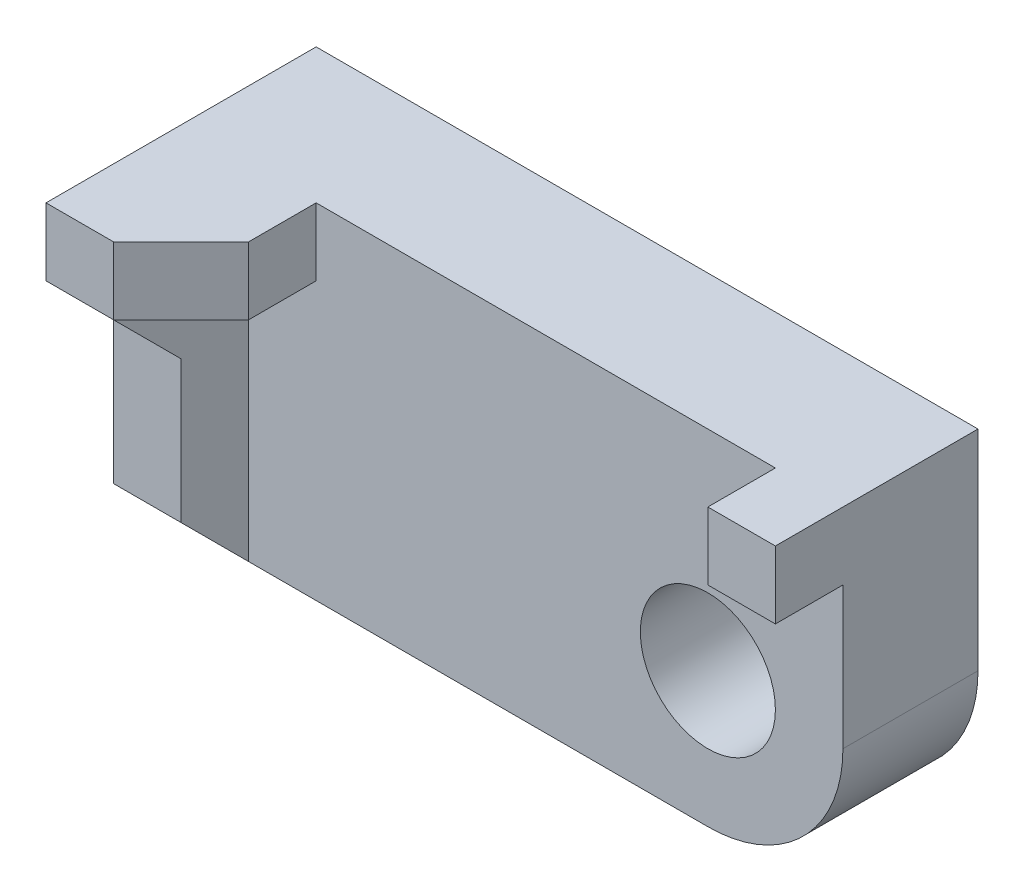
from build123d import *

# Parameters (mm, degrees)
SKETCH2_W               = 10
SKETCH2_H               = 10
BOSS_EXTRUDE2_DEPTH     = 30
SKETCH2_5_R             = 10
BOSS_EXTRUDE3_DEPTH     = 20
SKETCH2_6_W             = 10
SKETCH2_6_H             = 10
BOSS_EXTRUDE4_DEPTH     = 40
SKETCH2_7_W             = 10
SKETCH2_7_H             = 21
BOSS_EXTRUDE5_DEPTH     = 30
SKETCH2_8_W             = 10
SKETCH2_8_H             = 10
BOSS_EXTRUDE6_DEPTH     = 40
SKETCH2_9_W             = 10
SKETCH2_9_H             = 10
BOSS_EXTRUDE7_DEPTH     = 30
SKETCH2_10_W            = 10
SKETCH2_10_H            = 10
BOSS_EXTRUDE8_DEPTH     = 40
CUT_EXTRUDE3_DEPTH      = 114.512113891
CUT_EXTRUDE3_DEPTH_BACK = 10
CUT_EXTRUDE5_START      = -10
CUT_EXTRUDE5_DEPTH      = 10
CUT_EXTRUDE6_DEPTH      = 110.293183685
CUT_EXTRUDE6_DEPTH_BACK = 10


# Read off the part's stored shape, not the designer's step: Cut-Extrude5
with BuildPart() as part:
    # Sketch2 → Boss-Extrude2 (new body)
    with BuildSketch(Plane.XY):
        with Locations((93, -5)):
            Rectangle(SKETCH2_W, SKETCH2_H)
    extrude(amount=BOSS_EXTRUDE2_DEPTH)

    # Sketch2<5> → Boss-Extrude3 (add)
    with BuildSketch(Plane.XY):
        with BuildLine():
            Line((88, 0), (20, 0))
            Line((20, 0), (20, -10))
            Line((20, -10), (10, -10))
            Line((10, -10), (10, -20))
            Line((10, -20), (10, -41))
            Line((10, -41), (10, -51))
            Line((10, -51), (78, -51))
            ThreePointArc((78, -51), (92.142135624, -45.142135624), (98, -31))
            Line((98, -31), (98, -10))
            Line((98, -10), (88, -10))
            Line((88, -10), (88, 0))
        make_face()
        with Locations((78, -31)):
            Circle(SKETCH2_5_R, mode=Mode.SUBTRACT)
    extrude(amount=BOSS_EXTRUDE3_DEPTH)

    # Sketch2<7> → Boss-Extrude5 (add)
    with BuildSketch(Plane.XY):
        with Locations((5, -30.5)):
            Rectangle(SKETCH2_7_W, SKETCH2_7_H)
    extrude(amount=BOSS_EXTRUDE5_DEPTH)



with BuildPart() as body_2:
    # Sketch2<6> → Boss-Extrude4 (new body)
    with BuildSketch(Plane.XY):
        with Locations((5, -5)):
            Rectangle(SKETCH2_6_W, SKETCH2_6_H)
    extrude(amount=BOSS_EXTRUDE4_DEPTH)


with BuildPart() as part_1:
    add(part.part)

    add(body_2.part)  # Boss-Extrude6 merges body 2
    # Sketch2<8> → Boss-Extrude6 (add)
    with BuildSketch(Plane.XY):
        with Locations((15, -5)):
            Rectangle(SKETCH2_8_W, SKETCH2_8_H)
    extrude(amount=BOSS_EXTRUDE6_DEPTH)

    # Sketch2<9> → Boss-Extrude7 (add)
    with BuildSketch(Plane.XY):
        with Locations((5, -46)):
            Rectangle(SKETCH2_9_W, SKETCH2_9_H)
    extrude(amount=BOSS_EXTRUDE7_DEPTH)

    # Sketch2<10> → Boss-Extrude8 (add)
    with BuildSketch(Plane.XY):
        with Locations((5, -15)):
            Rectangle(SKETCH2_10_W, SKETCH2_10_H)
    extrude(amount=BOSS_EXTRUDE8_DEPTH)

    # Sketch6 → Cut-Extrude3 (cut, two sides: drawn at the far end of the back side and taken through both)
    with BuildSketch(Plane.XZ.offset(10).offset(-CUT_EXTRUDE3_DEPTH_BACK)):
        Polygon((20, 40), (10, 40), (20, 30), align=None)
    extrude(amount=CUT_EXTRUDE3_DEPTH + CUT_EXTRUDE3_DEPTH_BACK, mode=Mode.SUBTRACT)

    # Cut-Extrude5 outline → Cut-Extrude5 (cut)
    with BuildSketch(Plane(origin=(10, 0, 0), x_dir=(0, 0, -1), z_dir=(1, 0, 0)).offset(CUT_EXTRUDE5_START)):
        Polygon((-40, -20), (-30, -20), (-40, -10), align=None)
    extrude(amount=CUT_EXTRUDE5_DEPTH, mode=Mode.SUBTRACT)

    # Sketch8 → Cut-Extrude6 (cut, two sides: drawn at the far end of the back side and taken through both)
    with BuildSketch(Plane(origin=(10, 0, 0), x_dir=(0, 0, -1), z_dir=(1, 0, 0)).offset(-CUT_EXTRUDE6_DEPTH_BACK)):
        Polygon((64.543643605, -135.543643605), (-20, -51), (-30, -41), (-114.543643605, 43.543643605), (-283.630930815, -125.543643605), (-104.543643605, -304.630930815), align=None)
    extrude(amount=CUT_EXTRUDE6_DEPTH + CUT_EXTRUDE6_DEPTH_BACK, mode=Mode.SUBTRACT)


solid = part_1.part
